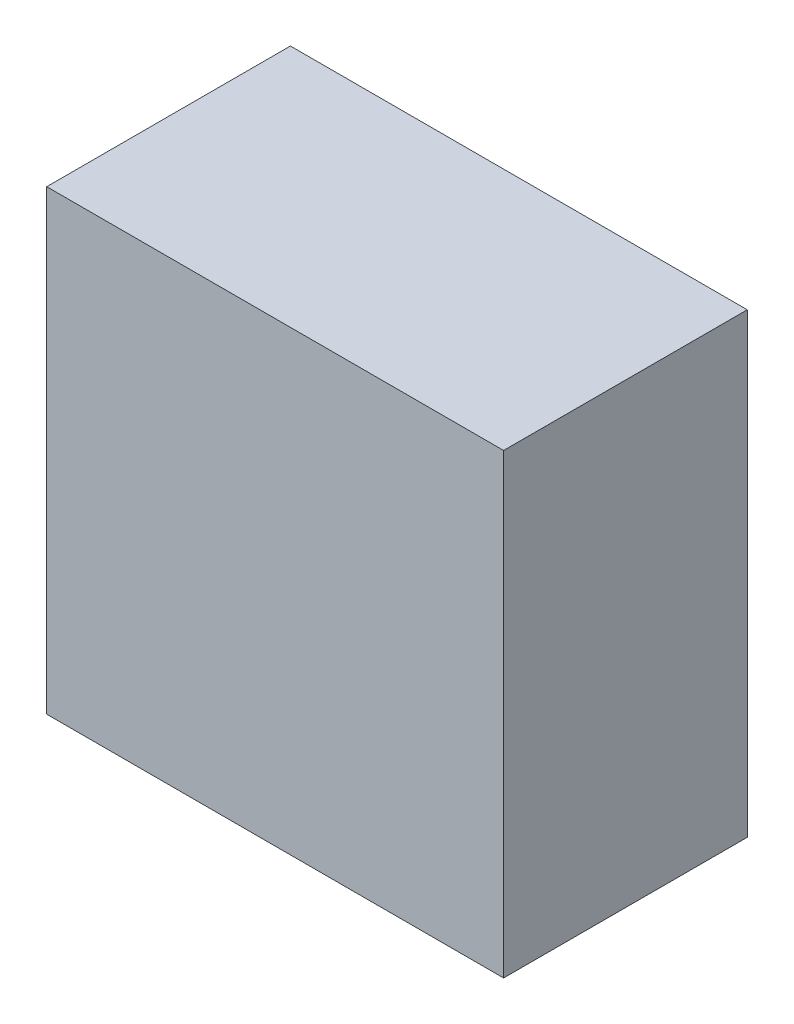
from build123d import *

# Parameters (mm, degrees)
SKETCH1_R           = 10
BOSS_EXTRUDE1_DEPTH = 5
SKETCH2_W           = 30
SKETCH2_H           = 30
SKETCH2_R           = 12
BOSS_EXTRUDE2_DEPTH = 6
SKETCH3_W           = 30
SKETCH3_H           = 30
BOSS_EXTRUDE3_DEPTH = 2


with BuildPart() as part:
    # Sketch1 → Boss-Extrude1 (new, symmetric)
    with BuildSketch(Plane.XY):
        Circle(SKETCH1_R)
    extrude(amount=BOSS_EXTRUDE1_DEPTH, both=True)


with BuildPart() as body_2:
    # Sketch2 → Boss-Extrude2 (new, symmetric)
    with BuildSketch(Plane.XY):
        Rectangle(SKETCH2_W, SKETCH2_H)
        Circle(SKETCH2_R, mode=Mode.SUBTRACT)
    extrude(amount=BOSS_EXTRUDE2_DEPTH, both=True)

    # Sketch3 → Boss-Extrude3 (add)
    with BuildSketch(Plane.XY.offset(6)):
        Rectangle(SKETCH3_W, SKETCH3_H)
    boss_extrude3 = extrude(amount=BOSS_EXTRUDE3_DEPTH)

    # Mirror1: Boss-Extrude3 across plane
    add(boss_extrude3.mirror(Plane.XY))


solid = Compound([part.part, body_2.part])
